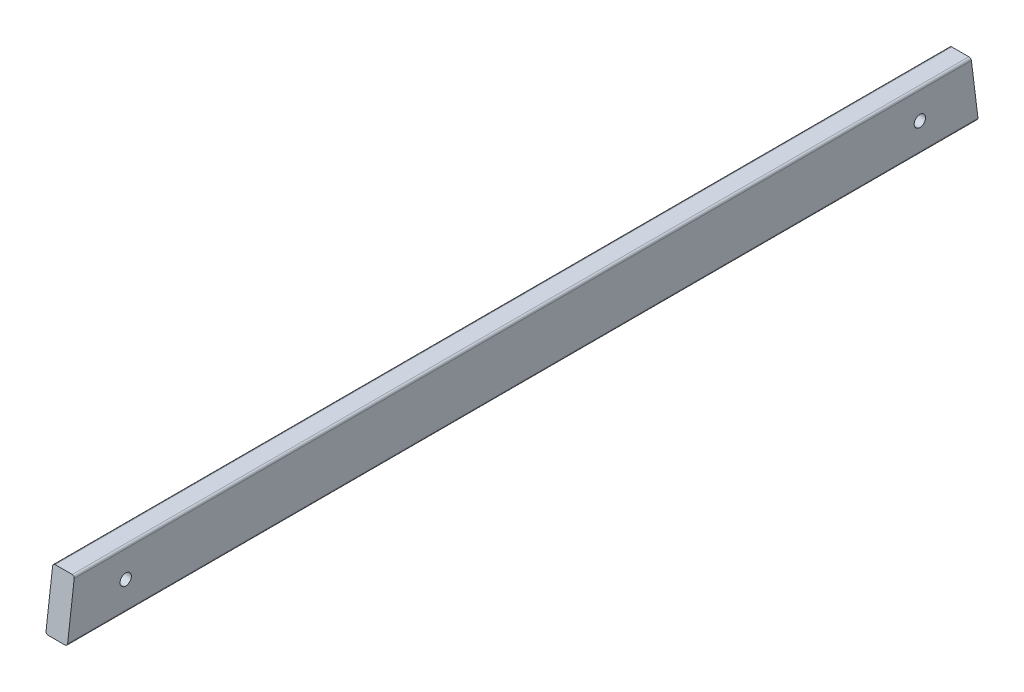
from build123d import *

# Parameters (mm, degrees)
ESBO_O1_W                 = 9.525
ESBO_O1_H                 = 25.4
RESSALTO_EXTRUS_O1_DEPTH  = 210
FILETE1_R                 = 1
CORTE_EXTRUS_O1_START     = -9.525
CORTE_EXTRUS_O1_DEPTH     = 9.525
FURO_ROSCADO_DE_M6X1_01_D = 5


# Read off the part's stored shape, not the designer's step: Corte-extrusão1
with BuildPart() as part:
    # Esboço1 → Ressalto-extrusão1 (new, symmetric)
    with BuildSketch(Plane.XY):
        Rectangle(ESBO_O1_W, ESBO_O1_H)
    extrude(amount=RESSALTO_EXTRUS_O1_DEPTH, both=True)

    # Filete1
    filete1_edges = [part.edges().sort_by_distance(p)[0] for p in [
        (4.7625, -12.7, 0),
        (-4.7625, -12.7, 0),
        (-4.7625, 12.7, 0),
        (4.7625, 12.7, 0),
    ]]
    fillet(filete1_edges, radius=FILETE1_R)

    # Corte-extrusão1 outline → Corte-extrusão1 (cut)
    with BuildSketch(Plane.ZY.offset(4.7625).offset(CORTE_EXTRUS_O1_START)):
        Polygon((197.587539651, 12.7), (200.73, -12.7), (210, -12.7), (210, 12.7), align=None)
        Polygon((-210, -12.7), (-200.73, -12.7), (-197.587539651, 12.7), (-210, 12.7), align=None)
    extrude(amount=CORTE_EXTRUS_O1_DEPTH, mode=Mode.SUBTRACT)

    # Furo roscado de M6x1.01 (through all)
    with Locations(Plane.ZY.offset(4.7625)):
        with Locations((-175, 0), (175, 0)):
            Hole(FURO_ROSCADO_DE_M6X1_01_D / 2)


solid = part.part
